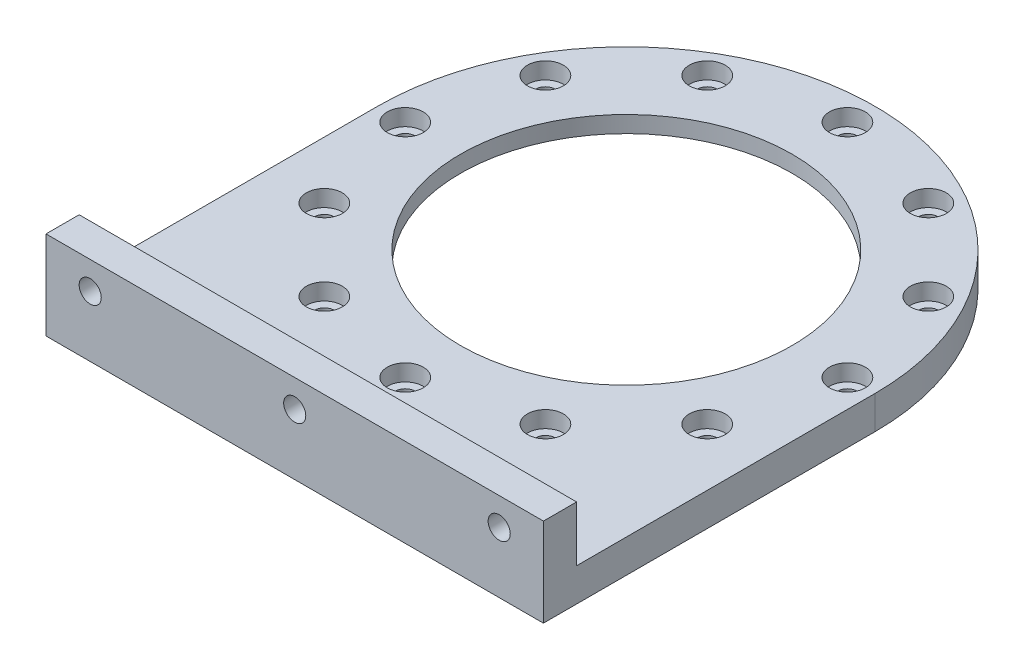
from build123d import *

# Parameters (mm, degrees)
SKETCH1_R           = 45
SKETCH1_R_2         = 30
SKETCH1_R_3         = 1.75
BOSS_EXTRUDE1_DEPTH = 6
SKETCH2_R           = 36
CUT_EXTRUDE1_DEPTH  = 3
SKETCH3_R           = 3.25
CUT_EXTRUDE2_DEPTH  = 3
BOSS_EXTRUDE4_DEPTH = 6
SKETCH5_W           = 90
SKETCH5_H           = 6
BOSS_EXTRUDE5_DEPTH = 10
SKETCH6_R           = 2
CUT_EXTRUDE3_DEPTH  = 8


with BuildPart() as part:
    # Sketch1 → Boss-Extrude1 (new body)
    with BuildSketch(Plane(origin=(0, 0, 0), x_dir=(1, 0, 0), z_dir=(0, 1, 0))):
        Circle(SKETCH1_R)
        Circle(SKETCH1_R_2, mode=Mode.SUBTRACT)
        with Locations((0, 40)):
            Circle(SKETCH1_R_3, mode=Mode.SUBTRACT)
        with Locations((20, 34.641016151)):
            Circle(SKETCH1_R_3, mode=Mode.SUBTRACT)
        with Locations((34.641016151, 20)):
            Circle(SKETCH1_R_3, mode=Mode.SUBTRACT)
        with Locations((40, 0)):
            Circle(SKETCH1_R_3, mode=Mode.SUBTRACT)
        with Locations((34.641016151, -20)):
            Circle(SKETCH1_R_3, mode=Mode.SUBTRACT)
        with Locations((20, -34.641016151)):
            Circle(SKETCH1_R_3, mode=Mode.SUBTRACT)
        with Locations((0, -40)):
            Circle(SKETCH1_R_3, mode=Mode.SUBTRACT)
        with Locations((-20, -34.641016151)):
            Circle(SKETCH1_R_3, mode=Mode.SUBTRACT)
        with Locations((-34.641016151, -20)):
            Circle(SKETCH1_R_3, mode=Mode.SUBTRACT)
        with Locations((-40, 0)):
            Circle(SKETCH1_R_3, mode=Mode.SUBTRACT)
        with Locations((-34.641016151, 20)):
            Circle(SKETCH1_R_3, mode=Mode.SUBTRACT)
        with Locations((-20, 34.641016151)):
            Circle(SKETCH1_R_3, mode=Mode.SUBTRACT)
    extrude(amount=BOSS_EXTRUDE1_DEPTH)

    # Sketch2 → Cut-Extrude1 (cut)
    with BuildSketch(Plane.XZ):
        Circle(SKETCH2_R)
    extrude(amount=-CUT_EXTRUDE1_DEPTH, mode=Mode.SUBTRACT)

    # Sketch3 → Cut-Extrude2 (cut)
    with BuildSketch(Plane(origin=(0, 6, 0), x_dir=(1, 0, 0), z_dir=(0, 1, 0))):
        with Locations((40, 0)):
            Circle(SKETCH3_R)
        with Locations((34.641016151, -20)):
            Circle(SKETCH3_R)
        with Locations((20, -34.641016151)):
            Circle(SKETCH3_R)
        with Locations((0, -40)):
            Circle(SKETCH3_R)
        with Locations((-20, -34.641016151)):
            Circle(SKETCH3_R)
        with Locations((-34.641016151, -20)):
            Circle(SKETCH3_R)
        with Locations((-40, 0)):
            Circle(SKETCH3_R)
        with Locations((-34.641016151, 20)):
            Circle(SKETCH3_R)
        with Locations((-20, 34.641016151)):
            Circle(SKETCH3_R)
        with Locations((0, 40)):
            Circle(SKETCH3_R)
        with Locations((20, 34.641016151)):
            Circle(SKETCH3_R)
        with Locations((34.641016151, 20)):
            Circle(SKETCH3_R)
    extrude(amount=-CUT_EXTRUDE2_DEPTH, mode=Mode.SUBTRACT)

    # Sketch4 → Boss-Extrude4 (add)
    with BuildSketch(Plane.XZ):
        with BuildLine():
            Line((45, 0), (45, 60))
            Line((45, 60), (-45, 60))
            Line((-45, 60), (-45, 0))
            ThreePointArc((-45, 0), (0, 45), (45, 0))
        make_face()
    extrude(amount=-BOSS_EXTRUDE4_DEPTH)

    # Sketch5 → Boss-Extrude5 (add)
    with BuildSketch(Plane(origin=(0, 6, 0), x_dir=(1, 0, 0), z_dir=(0, 1, 0))):
        with Locations((0, -57)):
            Rectangle(SKETCH5_W, SKETCH5_H)
    extrude(amount=BOSS_EXTRUDE5_DEPTH)

    # Sketch6 → Cut-Extrude3 (cut)
    with BuildSketch(Plane(origin=(0, 0, 54), x_dir=(-1, 0, 0), z_dir=(0, 0, -1))):
        with Locations((-37, 11)):
            Circle(SKETCH6_R)
        with Locations((37, 11)):
            Circle(SKETCH6_R)
        with Locations((0, 11)):
            Circle(SKETCH6_R)
    extrude(amount=-CUT_EXTRUDE3_DEPTH, mode=Mode.SUBTRACT)


solid = part.part
